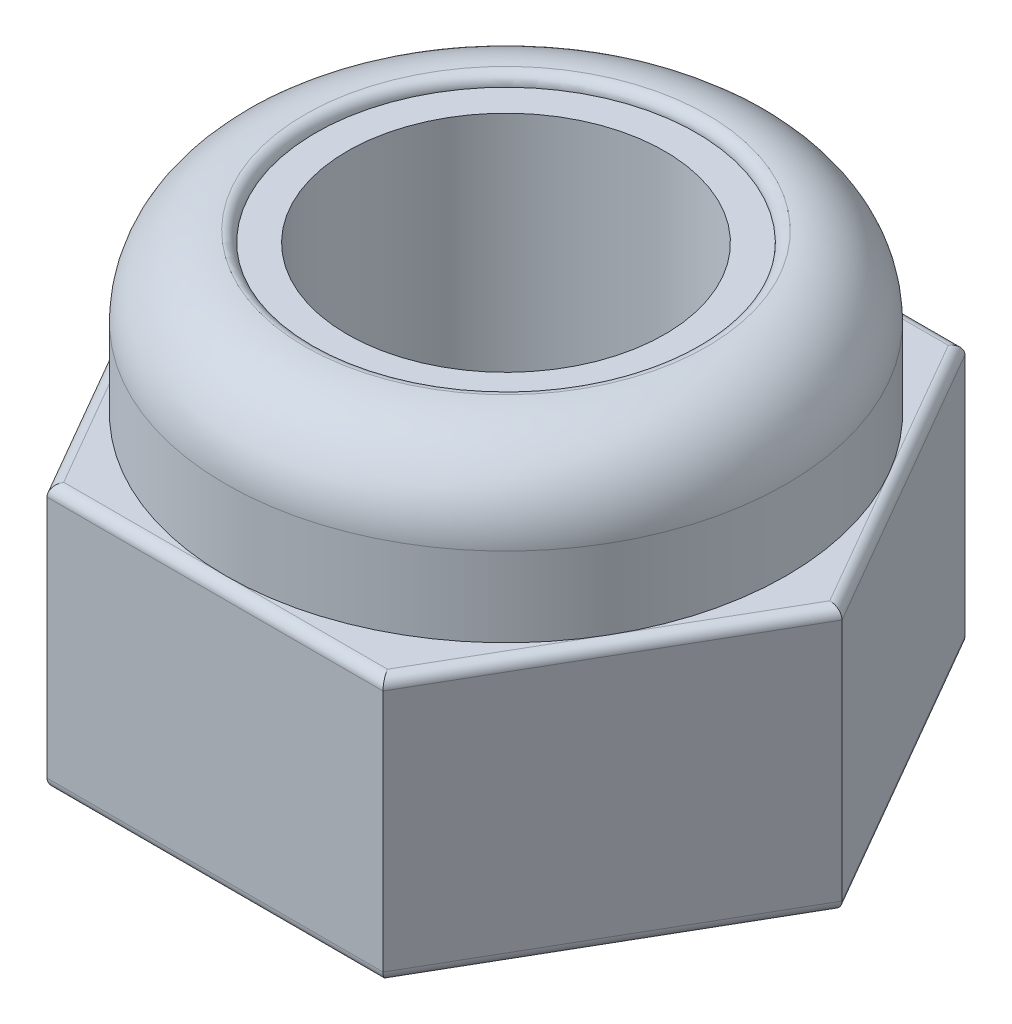
from build123d import *

# Parameters (mm, degrees)
SKETCH1_R           = 1.5
BOSS_EXTRUDE1_DEPTH = 4
FILLET1_R           = 0.1
CUT_EXTRUDE1_START  = -0.1
SKETCH3_R           = 1.8
SKETCH3_R_2         = 1.5
CUT_EXTRUDE1_DEPTH  = 0.1
FILLET2_R           = 0.1


with BuildPart() as part:
    # Sketch1 → Boss-Extrude1 (new body)
    with BuildSketch(Plane(origin=(0, 0, 0), x_dir=(1, 0, 0), z_dir=(0, 1, 0))):
        Polygon((1.58771324, -2.75), (3.175426481, 0), (1.58771324, 2.75), (-1.58771324, 2.75), (-3.175426481, 0), (-1.58771324, -2.75), align=None)
        with Locations(Location((0, 0, 0), (0, 0, 270))):
            Circle(SKETCH1_R, mode=Mode.SUBTRACT)
    extrude(amount=BOSS_EXTRUDE1_DEPTH)

    # Sketch2 → Cut-Revolve3 (revolve, cut)
    with BuildSketch(Plane(origin=(0, 0, 0), x_dir=(0, 0, -1), z_dir=(1, 0, 0))):
        with BuildLine():
            Line((-2.65, 3.25), (-2.65, 2.5))
            Line((-2.65, 2.5), (-5.25, 2.5))
            Line((-5.25, 2.5), (-5.25, 4))
            Line((-5.25, 4), (-5.25, 4.1))
            Line((-5.25, 4.1), (-1.9, 4.1))
            Line((-1.9, 4.1), (-1.9, 4))
            ThreePointArc((-1.9, 4), (-2.430330086, 3.780330086), (-2.65, 3.25))
        make_face()
    revolve(axis=Axis((0, 4, 0), (0, -1, 0)), mode=Mode.SUBTRACT)

    # Fillet1
    fillet1_edges = [part.edges().sort_by_distance(p)[0] for p in [
        (0, 0, -1.5),
        (-2.38156986, 2.5, 1.375),
        (2.38156986, 2.5, 1.375),
        (0, 2.5, 2.75),
        (-2.38156986, 2.5, -1.375),
        (0, 2.5, -2.75),
        (2.38156986, 2.5, -1.375),
        (-2.38156986, 0, 1.375),
        (-2.38156986, 0, -1.375),
        (0, 0, -2.75),
        (2.38156986, 0, -1.375),
        (2.38156986, 0, 1.375),
        (0, 0, 2.75),
    ]]
    fillet(fillet1_edges, radius=FILLET1_R - 0.0001)  # a hair under: the kernel refuses the full size

    # Sketch3 → Cut-Extrude1 (cut)
    with BuildSketch(Plane(origin=(0, 4, 0), x_dir=(1, 0, 0), z_dir=(0, 1, 0)).offset(CUT_EXTRUDE1_START)):
        with Locations(Location((0, 0, 0), (0, 0, 270))):
            Circle(SKETCH3_R)
        with Locations(Location((0, 0, 0), (0, 0, 270))):
            Circle(SKETCH3_R_2, mode=Mode.SUBTRACT)
    extrude(amount=CUT_EXTRUDE1_DEPTH, mode=Mode.SUBTRACT)

    # Fillet2
    fillet2_edges = [part.edges().sort_by_distance(p)[0] for p in [
        (0, 4, -1.8),
    ]]
    fillet(fillet2_edges, radius=FILLET2_R - 0.0001)  # a hair under: the kernel refuses the full size


solid = part.part
